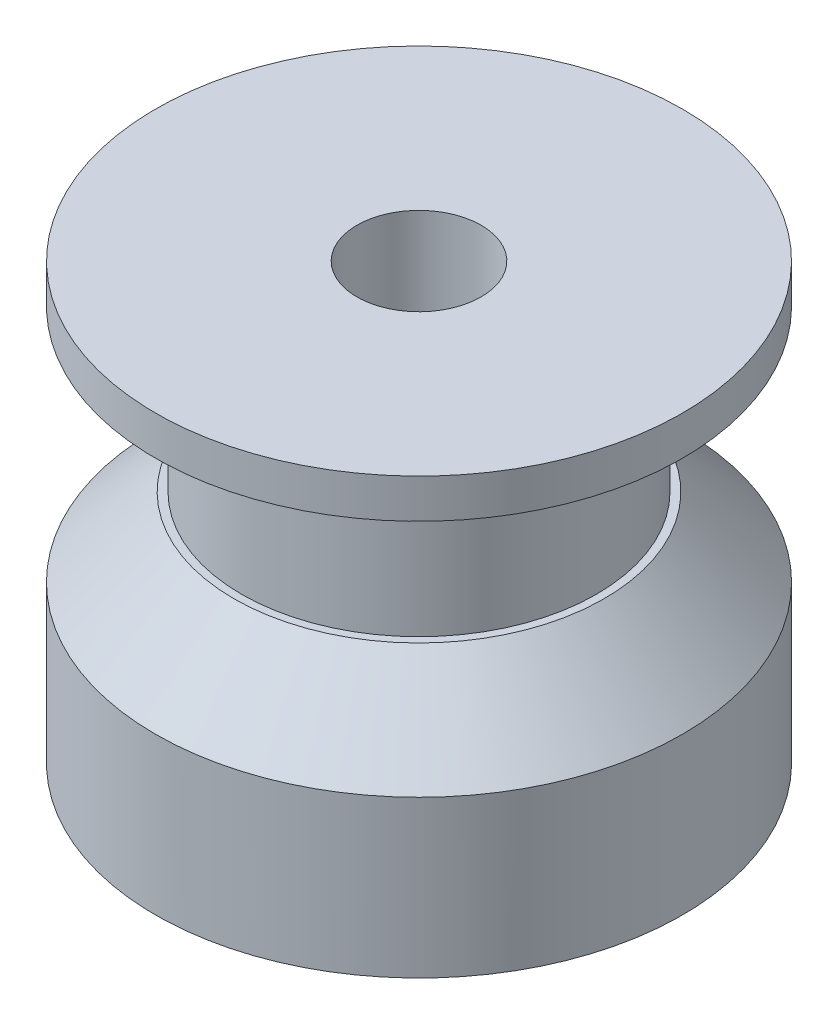
from build123d import *

# Parameters (mm, degrees)
CHAMFER1_SIZE = 2


with BuildPart() as part:
    # Sketch1 → Revolve1 (revolve)
    with BuildSketch(Plane.XY):
        Polygon((1.5875, 0), (1.5875, 11.105399902), (6.73, 11.105399902), (6.73, 10.105399902), (4.535, 10.105399902), (4.535, 6), (6.731, 6), (6.731, 0), align=None)
    revolve(axis=Axis((0, 0, 0), (0, 1, 0)))

    # Chamfer1
    chamfer1_edges = [part.edges().sort_by_distance(p)[0] for p in [
        (-6.731, 6, 0),
    ]]
    chamfer(chamfer1_edges, length=CHAMFER1_SIZE)


solid = part.part
